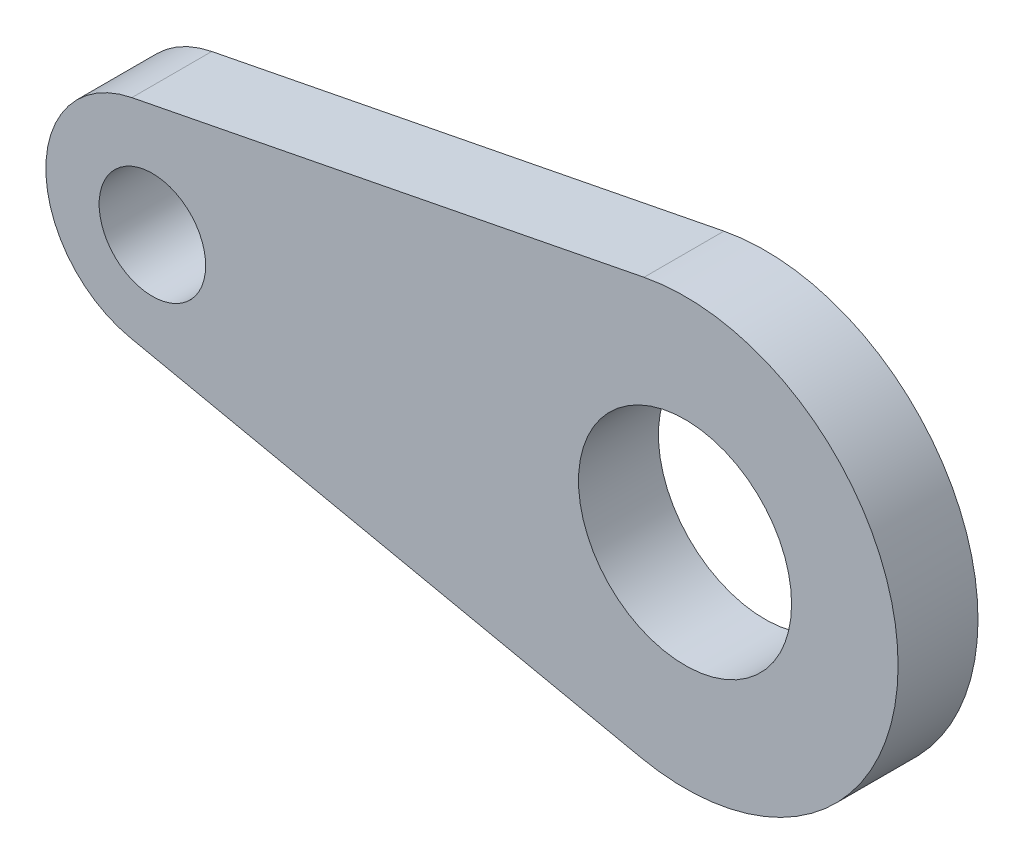
from build123d import *

# Parameters (mm, degrees)
ESBO_O1_R                = 10
ESBO_O1_R_2              = 20
RESSALTO_EXTRUS_O3_DEPTH = 15


with BuildPart() as part:
    # Esboço1 → Ressalto-extrusão3 (new body)
    with BuildSketch(Plane.XY):
        with BuildLine():
            ThreePointArc((-3.850348444, 20.388392962), (-19.999418586, 0.915021788), (-4.149186431, -18.802351058))
            Line((-4.149186431, -18.802351058), (91.701627138, -39.129745819))
            ThreePointArc((91.701627138, -39.129745819), (139.998837172, -0.304999874), (92.299303111, 39.251742222))
            Line((92.299303111, 39.251742222), (-3.850348444, 20.388392962))
        make_face()
        Circle(ESBO_O1_R, mode=Mode.SUBTRACT)
        with Locations((100, 0)):
            Circle(ESBO_O1_R_2, mode=Mode.SUBTRACT)
    extrude(amount=RESSALTO_EXTRUS_O3_DEPTH)


solid = part.part
